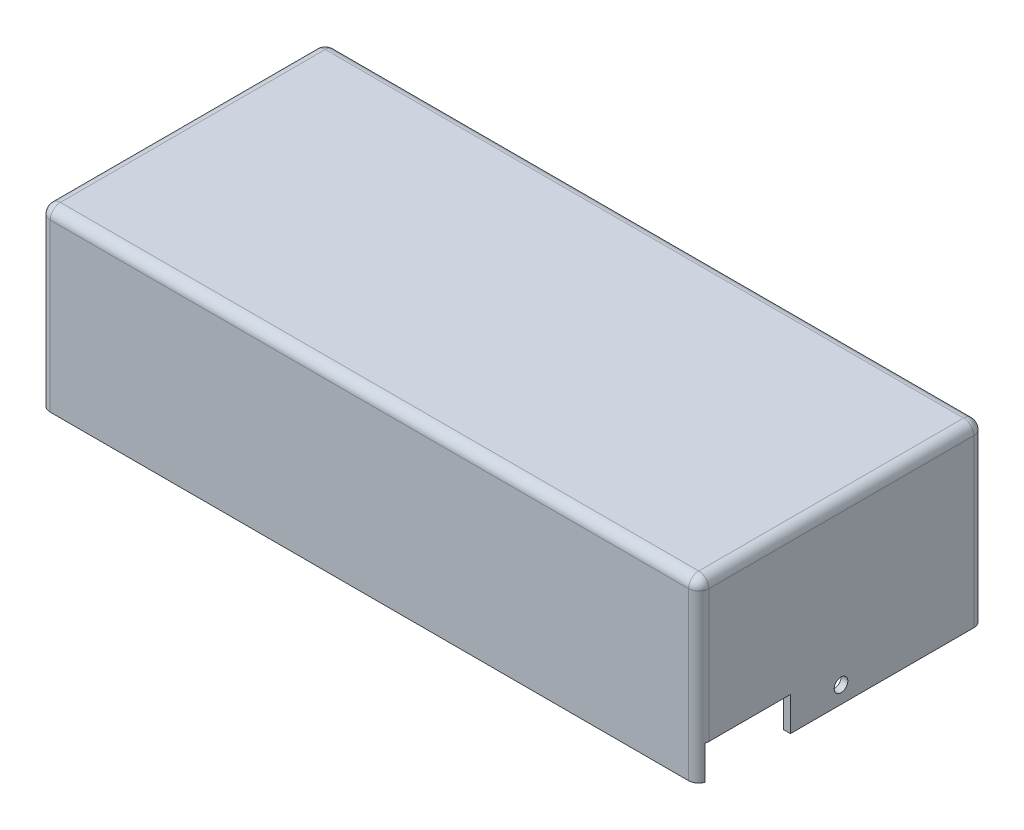
from build123d import *

# Parameters (mm, degrees)
SKETCH1_W                 = 194
SKETCH1_H                 = 52
BOSS_EXTRUDE1_DEPTH       = 84
SKETCH2_W                 = 190
SKETCH2_H                 = 80
CUT_EXTRUDE1_DEPTH        = 50
FILLET1_R                 = 1
FILLET2_R                 = 1
FILLET3_R                 = 1
FILLET4_R                 = 3
FILLET5_R                 = 3
SKETCH3_W                 = 25
SKETCH3_H                 = 10
CUT_EXTRUDE2_DEPTH        = 5
F_4_0MM_DOWEL_HOLE1_D     = 4
F_4_0MM_DOWEL_HOLE1_DEPTH = 20
F_4_0MM_DOWEL_HOLE1_TIP   = 1.201721238
F_4_0MM_DOWEL_HOLE2_D     = 4
F_4_0MM_DOWEL_HOLE2_DEPTH = 20
F_4_0MM_DOWEL_HOLE2_TIP   = 1.201721238


with BuildPart() as part:
    # Sketch1 → Boss-Extrude1 (new body)
    with BuildSketch(Plane.XY):
        with Locations((97, 26)):
            Rectangle(SKETCH1_W, SKETCH1_H)
    extrude(amount=BOSS_EXTRUDE1_DEPTH)

    # Sketch2 → Cut-Extrude1 (cut)
    with BuildSketch(Plane.XZ):
        with Locations((97, 42)):
            Rectangle(SKETCH2_W, SKETCH2_H)
    extrude(amount=-CUT_EXTRUDE1_DEPTH, mode=Mode.SUBTRACT)

    # Fillet1
    fillet1_edges = [part.edges().sort_by_distance(p)[0] for p in [
        (97, 50, 2),
        (2, 50, 42),
        (2, 25, 2),
    ]]
    fillet(fillet1_edges, radius=FILLET1_R)

    # Fillet2
    fillet2_edges = [part.edges().sort_by_distance(p)[0] for p in [
        (97.5, 50, 82),
        (2, 24.5, 82),
        (2.292893219, 49.707106781, 82),
    ]]
    fillet(fillet2_edges, radius=FILLET2_R)

    # Fillet3
    fillet3_edges = [part.edges().sort_by_distance(p)[0] for p in [
        (192, 50, 42),
        (192, 24.5, 2),
        (192, 49.707106781, 2.292893219),
        (192, 24.5, 82),
        (192, 49.707106781, 81.707106781),
    ]]
    fillet(fillet3_edges, radius=FILLET3_R)

    # Fillet4
    fillet4_edges = [part.edges().sort_by_distance(p)[0] for p in [
        (194, 26, 84),
        (97, 52, 84),
        (0, 26, 84),
        (194, 52, 42),
    ]]
    fillet(fillet4_edges, radius=FILLET4_R)

    # Fillet5
    # the kernel refuses this fillet: 3 mm, written as the material it takes off along each edge
    with BuildSketch(Plane(origin=(3, 49, 81), x_dir=(0, 1, 0), z_dir=(-1, 0, 0))) as fillet5_piece_1_section:
        Polygon((0, 0), (FILLET5_R, 0), (FILLET5_R, -FILLET5_R), (0, -FILLET5_R), align=None)
    fillet5_piece_1 = extrude(amount=FILLET5_R, mode=Mode.PRIVATE)
    fillet5_piece_1 = fillet5_piece_1 - Plane(origin=(3, 49, 81), x_dir=(0, -0.7071067811865475, -0.7071067811865475), z_dir=(-1, 0, 0)) * Sphere(FILLET5_R, mode=Mode.PRIVATE)
    add(fillet5_piece_1, mode=Mode.SUBTRACT)
    with BuildSketch(Plane(origin=(3, 49, 3), x_dir=(0, 0, -1), z_dir=(-1, 0, 0))) as fillet5_piece_2_section:
        Polygon((0, 0), (FILLET5_R, 0), (FILLET5_R, -FILLET5_R), (0, -FILLET5_R), align=None)
    fillet5_piece_2 = extrude(amount=FILLET5_R, mode=Mode.PRIVATE)
    fillet5_piece_2 = fillet5_piece_2 - Plane(origin=(3, 49, 3), x_dir=(0, -0.7071067811865475, 0.7071067811865475), z_dir=(-1, 0, 0)) * Sphere(FILLET5_R, mode=Mode.PRIVATE)
    add(fillet5_piece_2, mode=Mode.SUBTRACT)
    with BuildSketch(Plane(origin=(194, -7.5, 0), x_dir=(-1, 0, 0), z_dir=(0, 1, 0))) as fillet5_piece_3:
        with BuildLine():
            CenterArc((FILLET5_R, FILLET5_R), FILLET5_R, 180, 90)
            Line((0, FILLET5_R), (0, 0))
            Line((0, 0), (FILLET5_R, 0))
        make_face()
    extrude(amount=56.5, mode=Mode.SUBTRACT)
    with BuildSketch(Plane(origin=(0, 49, 0), x_dir=(0, 0, 1), z_dir=(0, -1, 0))) as fillet5_piece_4:
        with BuildLine():
            CenterArc((FILLET5_R, -FILLET5_R), FILLET5_R, 90, 90)
            Line((0, -FILLET5_R), (0, 0))
            Line((0, 0), (FILLET5_R, 0))
        make_face()
    extrude(amount=56.5, mode=Mode.SUBTRACT)
    with BuildSketch(Plane(origin=(191, 52, 0), x_dir=(0, -1, 0), z_dir=(-1, 0, 0))) as fillet5_piece_5:
        with BuildLine():
            CenterArc((FILLET5_R, FILLET5_R), FILLET5_R, 180, 90)
            Line((0, FILLET5_R), (0, 0))
            Line((0, 0), (FILLET5_R, 0))
        make_face()
    extrude(amount=188, mode=Mode.SUBTRACT)
    with BuildSketch(Plane(origin=(0, 52, 3), x_dir=(0, -1, 0), z_dir=(0, 0, 1))) as fillet5_piece_6:
        with BuildLine():
            CenterArc((FILLET5_R, FILLET5_R), FILLET5_R, 180, 90)
            Line((0, FILLET5_R), (0, 0))
            Line((0, 0), (FILLET5_R, 0))
        make_face()
    extrude(amount=78, mode=Mode.SUBTRACT)
    with BuildSketch(Plane(origin=(191, 49, 0), x_dir=(1, 0, 0), z_dir=(0, -1, 0))) as fillet5_piece_7:
        with BuildLine():
            CenterArc((3 - FILLET5_R, FILLET5_R), FILLET5_R, 270, 90)
            Line((3, FILLET5_R), (3, 0))
            Line((3, 0), (3 - FILLET5_R, 0))
        make_face()
    revolve(axis=Axis((191, 49, 0), (0, 0, 1)), revolution_arc=90, mode=Mode.SUBTRACT)

    # Sketch3 → Cut-Extrude2 (cut)
    with BuildSketch(Plane(origin=(194, 0, 0), x_dir=(0, 0, -1), z_dir=(1, 0, 0))):
        with Locations((-69.5, 5)):
            Rectangle(SKETCH3_W, SKETCH3_H)
    extrude(amount=-CUT_EXTRUDE2_DEPTH, mode=Mode.SUBTRACT)

    # Ø4.0mm Dowel Hole1
    with Locations(Plane(origin=(194, 5, 42.107279869), x_dir=(0, 0, 1), z_dir=(1, 0, 0))):
        with Locations((0, 0)):
            Hole(F_4_0MM_DOWEL_HOLE1_D / 2, depth=F_4_0MM_DOWEL_HOLE1_DEPTH)
            with Locations((0, 0, -(F_4_0MM_DOWEL_HOLE1_DEPTH + F_4_0MM_DOWEL_HOLE1_TIP / 2))):  # 118° drill point
                Cone(0, F_4_0MM_DOWEL_HOLE1_D / 2, F_4_0MM_DOWEL_HOLE1_TIP, mode=Mode.SUBTRACT)

    # Ø4.0mm Dowel Hole2
    with Locations(Plane(origin=(0, 5, 41.892720131), x_dir=(0, 0, -1), z_dir=(-1, 0, 0))):
        with Locations((0, 0)):
            Hole(F_4_0MM_DOWEL_HOLE2_D / 2, depth=F_4_0MM_DOWEL_HOLE2_DEPTH)
            with Locations((0, 0, -(F_4_0MM_DOWEL_HOLE2_DEPTH + F_4_0MM_DOWEL_HOLE2_TIP / 2))):  # 118° drill point
                Cone(0, F_4_0MM_DOWEL_HOLE2_D / 2, F_4_0MM_DOWEL_HOLE2_TIP, mode=Mode.SUBTRACT)


solid = part.part
